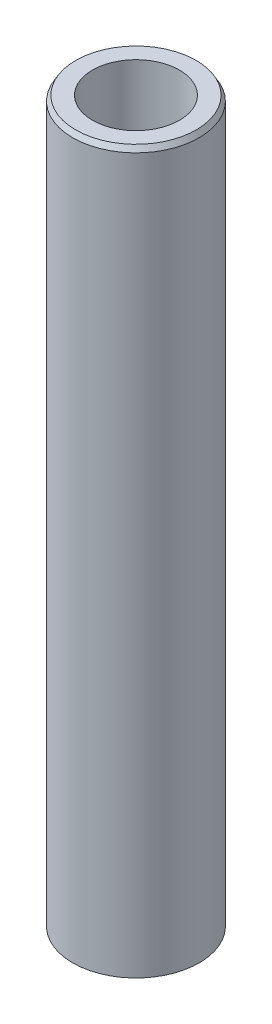
from build123d import *
from OCP.BRepFilletAPI import BRepFilletAPI_MakeChamfer

# Parameters (mm, degrees)
SKETCH1_R           = 52.5
BOSS_EXTRUDE1_DEPTH = 600
SKETCH2_R           = 36.107709161
CUT_EXTRUDE1_DEPTH  = 605.576297914
CHAMFER1_SIZE       = 4.359752782
CHAMFER1_SIZE2      = 2.517104443


with BuildPart() as part:
    # Sketch1 → Boss-Extrude1 (new body)
    with BuildSketch(Plane(origin=(0, 0, 0), x_dir=(1, 0, 0), z_dir=(0, 1, 0))):
        Circle(SKETCH1_R)
    extrude(amount=BOSS_EXTRUDE1_DEPTH)

    # Sketch2 → Cut-Extrude1 (cut, through all)
    with BuildSketch(Plane(origin=(0, 0, 0), x_dir=(1, 0, 0), z_dir=(0, 1, 0))):
        Circle(SKETCH2_R)
    extrude(amount=CUT_EXTRUDE1_DEPTH, mode=Mode.SUBTRACT)

    # Chamfer1: one chamfer whose edges measure the first distance from different faces: ONE call of the kernel's chamfer builder (chamfer() names one face for all edges)
    chamfer1_edges_1 = [part.edges().sort_by_distance(p)[0] for p in [
        (-52.5, 600, 0),
    ]]
    chamfer1_side_1 = [part.faces().sort_by_distance(p)[0] for p in [
        (-52.5, 300, 0),
    ]]
    chamfer1_edges_2 = [part.edges().sort_by_distance(p)[0] for p in [
        (-52.5, 0, 0),
    ]]
    chamfer1_side_2 = [part.faces().sort_by_distance(p)[0] for p in [
        (-51.01507576, 0, 0),
    ]]
    chamfer1 = BRepFilletAPI_MakeChamfer(part.part.solid().wrapped)
    for e in chamfer1_edges_1:
        chamfer1.Add(CHAMFER1_SIZE, CHAMFER1_SIZE2, e.wrapped, chamfer1_side_1[0].wrapped)  # the first distance lies on this face
    for e in chamfer1_edges_2:
        chamfer1.Add(CHAMFER1_SIZE, CHAMFER1_SIZE2, e.wrapped, chamfer1_side_2[0].wrapped)  # the first distance lies on this face
    add(Compound.cast(chamfer1.Shape()), mode=Mode.REPLACE)


solid = part.part
